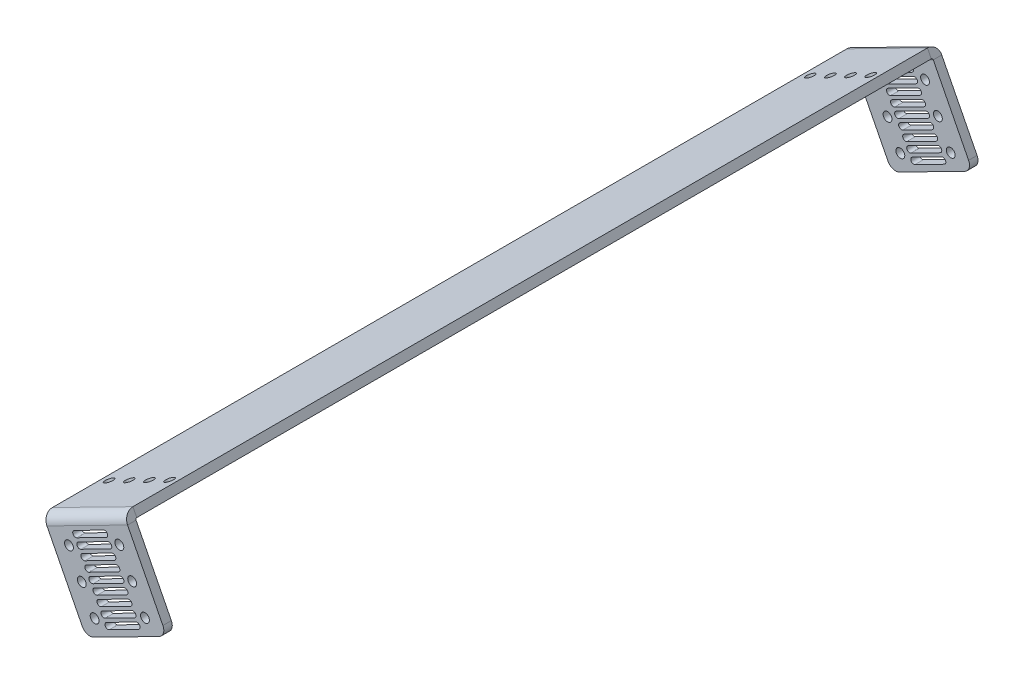
from build123d import *

# Parameters (mm, degrees)
BASE_FLANGE1_DEPTH = 50.8
FILLET1_R          = 4.7625
SKETCH18_R         = 2.4892
CUT_EXTRUDE1_DEPTH = 620.376518124
SKETCH20_R         = 2.4892
CUT_EXTRUDE2_DEPTH = 935.779827906
LPATTERN1_START    = -228.6
LPATTERN1_DEPTH    = 457.2


# Read off the part's stored shape, not the designer's step: LPattern1
# Sheet-metal steps are written as plain solids
with BuildPart() as part:
    # Sketch17 → Base-Flange1 (new body)
    with BuildSketch(Plane(origin=(494.7314495, 252.078264185, 0), x_dir=(0, 0, -1), z_dir=(0.8910065241883655, 0.4539904997395516, 0))):
        with BuildLine():
            Line((-228.6, 533.849573814), (-228.6, 582.300073814))
            ThreePointArc((-228.6, 582.300073814), (-226.981911413, 586.206485227), (-223.0755, 587.824573814))
            Line((-223.0755, 587.824573814), (223.0755, 587.824573814))
            ThreePointArc((223.0755, 587.824573814), (226.981911413, 586.206485227), (228.6, 582.300073814))
            Line((228.6, 582.300073814), (228.6, 533.849573814))
            Line((228.6, 533.849573814), (223.8375, 533.849573814))
            Line((223.8375, 533.849573814), (223.8375, 582.300073814))
            ThreePointArc((223.8375, 582.300073814), (223.614315367, 582.838889181), (223.0755, 583.062073814))
            Line((223.0755, 583.062073814), (-223.0755, 583.062073814))
            ThreePointArc((-223.0755, 583.062073814), (-223.614315367, 582.838889181), (-223.8375, 582.300073814))
            Line((-223.8375, 582.300073814), (-223.8375, 533.849573814))
            Line((-223.8375, 533.849573814), (-228.6, 533.849573814))
        make_face()
    extrude(amount=-BASE_FLANGE1_DEPTH)

    # Fillet1
    fillet1_edges = [part.edges().sort_by_distance(p)[0] for p in [
        (252.368814698, 727.741717389, -226.21875),
        (252.368814698, 727.741717389, 226.21875),
        (207.105683269, 704.679000002, -226.21875),
        (207.105683269, 704.679000002, 226.21875),
    ]]
    fillet(fillet1_edges, radius=FILLET1_R)

    # Sketch18 → Cut-Extrude1 (cut, through all)
    with BuildSketch(Plane(origin=(-264.70464227, 519.512111775, 0), x_dir=(0.8910065241883653, 0.4539904997395517, 0), z_dir=(0.4539904997395517, -0.8910065241883653, 0))):
        with Locations((536.200086356, -196.85)):
            Circle(SKETCH18_R)
        with Locations((548.900086356, -196.85)):
            Circle(SKETCH18_R)
        with Locations((523.500086356, -196.85)):
            Circle(SKETCH18_R)
        with Locations((510.800086356, -196.85)):
            Circle(SKETCH18_R)
    cut_extrude1 = extrude(amount=-CUT_EXTRUDE1_DEPTH, mode=Mode.SUBTRACT)

    # Mirror1: Cut-Extrude1 across plane
    add(cut_extrude1.mirror(Plane.XY), mode=Mode.SUBTRACT)

    # Sketch20 → Cut-Extrude2 (cut, through all)
    with BuildSketch(Plane(origin=(0, 0, -228.6), x_dir=(-1, 0, 0), z_dir=(0, 0, -1))):
        with Locations((-240.170605262, 730.70143613)):
            Circle(SKETCH20_R)
        with Locations((-232.963506079, 744.846164702)):
            Circle(SKETCH20_R)
        with Locations((-204.674048936, 730.431966335)):
            Circle(SKETCH20_R)
        with Locations((-211.881148119, 716.287237764)):
            Circle(SKETCH20_R)
        with Locations((-197.466949753, 744.576694907)):
            Circle(SKETCH20_R)
        with Locations((-225.756406896, 758.990893273)):
            Circle(SKETCH20_R)
        with BuildLine():
            Line((-235.084869956, 726.089937384), (-218.601249184, 717.691113101))
            ThreePointArc((-218.601249184, 717.691113101), (-217.902023556, 715.539117896), (-220.054018761, 714.839892268))
            Line((-220.054018761, 714.839892268), (-236.537639533, 723.238716552))
            ThreePointArc((-236.537639533, 723.238716552), (-237.236865161, 725.390711756), (-235.084869956, 726.089937384))
        make_face()
    extrude(amount=-CUT_EXTRUDE2_DEPTH, mode=Mode.SUBTRACT)

    # LPattern1 outline → LPattern1 (cut)
    with BuildSketch(Plane.XY.offset(LPATTERN1_START)):
        with BuildLine():
            ThreePointArc((200.441629536, 753.331373399), (199.742403908, 751.179378195), (201.894399112, 750.480152566))
            Line((201.894399112, 750.480152566), (218.378019885, 758.878976849))
            ThreePointArc((218.378019885, 758.878976849), (219.077245513, 761.030972054), (216.925250308, 761.730197682))
            Line((216.925250308, 761.730197682), (200.441629536, 753.331373399))
        make_face()
        with BuildLine():
            ThreePointArc((202.711581992, 748.876340861), (202.012356364, 746.724345657), (204.164351568, 746.025120028))
            Line((204.164351568, 746.025120028), (220.647972341, 754.423944312))
            ThreePointArc((220.647972341, 754.423944312), (221.347197969, 756.575939517), (219.195202764, 757.275165145))
            Line((219.195202764, 757.275165145), (202.711581992, 748.876340861))
        make_face()
        with BuildLine():
            ThreePointArc((204.981534448, 744.421308324), (204.28230882, 742.26931312), (206.434304024, 741.570087491))
            Line((206.434304024, 741.570087491), (222.917924797, 749.968911775))
            ThreePointArc((222.917924797, 749.968911775), (223.617150425, 752.12090698), (221.46515522, 752.820132607))
            Line((221.46515522, 752.820132607), (204.981534448, 744.421308324))
        make_face()
        with BuildLine():
            ThreePointArc((207.251486904, 739.966275787), (206.552261276, 737.814280582), (208.704256481, 737.115054954))
            Line((208.704256481, 737.115054954), (225.187877253, 745.513879237))
            ThreePointArc((225.187877253, 745.513879237), (225.887102881, 747.665874442), (223.735107676, 748.36510007))
            Line((223.735107676, 748.36510007), (207.251486904, 739.966275787))
        make_face()
        with BuildLine():
            ThreePointArc((209.52143936, 735.51124325), (208.822213732, 733.359248045), (210.974208937, 732.660022417))
            Line((210.974208937, 732.660022417), (227.457829709, 741.0588467))
            ThreePointArc((227.457829709, 741.0588467), (228.157055337, 743.210841905), (226.005060132, 743.910067533))
            Line((226.005060132, 743.910067533), (209.52143936, 735.51124325))
        make_face()
        with BuildLine():
            ThreePointArc((211.791391816, 731.056210713), (211.092166188, 728.904215508), (213.244161393, 728.20498988))
            Line((213.244161393, 728.20498988), (229.727782165, 736.603814163))
            ThreePointArc((229.727782165, 736.603814163), (230.427007793, 738.755809368), (228.275012588, 739.455034996))
            Line((228.275012588, 739.455034996), (211.791391816, 731.056210713))
        make_face()
        with BuildLine():
            ThreePointArc((214.061344272, 726.601178175), (213.362118644, 724.44918297), (215.514113849, 723.749957343))
            Line((215.514113849, 723.749957343), (231.997734621, 732.148781626))
            ThreePointArc((231.997734621, 732.148781626), (232.696960249, 734.300776831), (230.544965044, 735.000002459))
            Line((230.544965044, 735.000002459), (214.061344272, 726.601178175))
        make_face()
        with BuildLine():
            ThreePointArc((216.331296728, 722.146145638), (215.6320711, 719.994150433), (217.784066305, 719.294924805))
            Line((217.784066305, 719.294924805), (234.267687077, 727.693749089))
            ThreePointArc((234.267687077, 727.693749089), (234.966912705, 729.845744294), (232.8149175, 730.544969922))
            Line((232.8149175, 730.544969922), (216.331296728, 722.146145638))
        make_face()
    extrude(amount=LPATTERN1_DEPTH, mode=Mode.SUBTRACT)


solid = part.part
